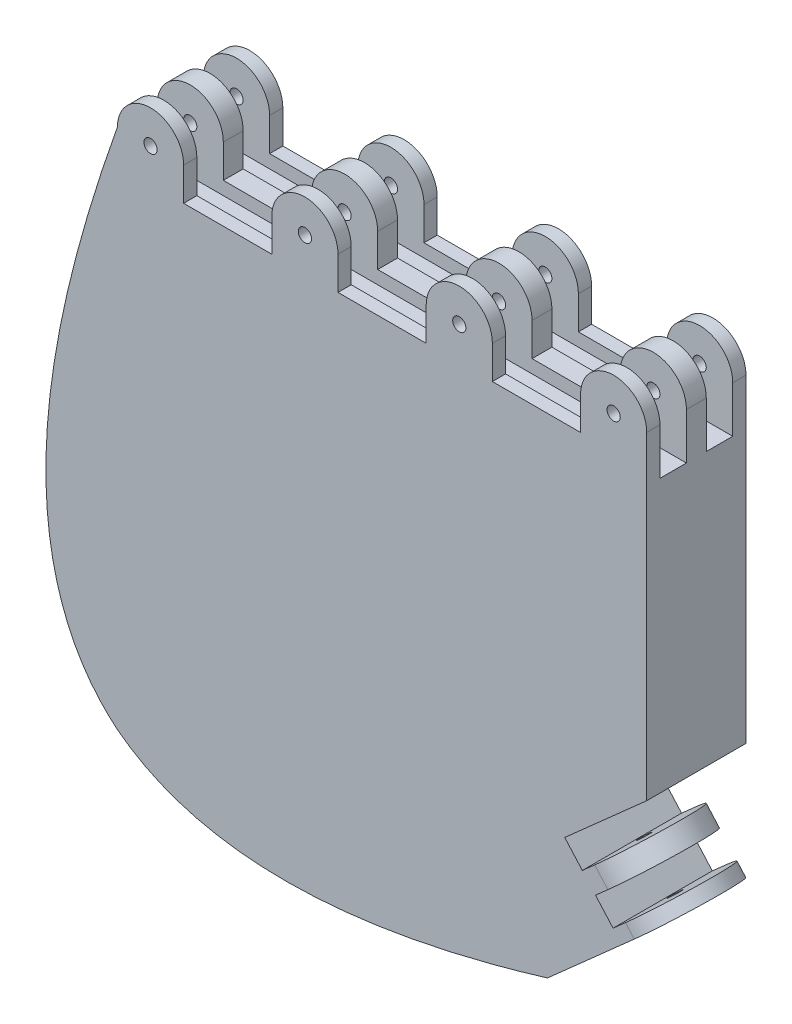
from build123d import *

# Parameters (mm, degrees)
BOSS_EXTRU_1_DEPTH      = 12.5
BOSS_EXTRU_1_DEPTH_BACK = 2.5
ESQUISSE1_R             = 1
ESQUISSE2_W             = 4
ESQUISSE2_H             = 12
ENL_V_MAT_EXTRU_1_DEPTH = 113.378931374
ESQUISSE3_R             = 1
ENL_V_MAT_EXTRU_2_DEPTH = 12.5


with BuildPart() as part:
    # Esquisse1 → Boss.-Extru.1 (new, two sides: drawn at the far end of the back side and taken through both)
    with BuildSketch(Plane.XY.offset(-BOSS_EXTRU_1_DEPTH_BACK)):
        with BuildLine():
            add(Edge.make_bspline(
                [(-75, -18.910504263), (-56.686373288, -33.096877551), (-10, -18.910504263)],
                knots=[0.563496207, 0.563496207, 0.563496207, 1, 1, 1], degree=2))
            Line((-10, -18.910504263), (8.718662863, -2.287994294))
            Line((8.718662863, -2.287994294), (7.390662863, -0.792529149))
            Line((7.390662863, -0.792529149), (-0.086662863, -7.432529149))
            Line((-0.086662863, -7.432529149), (-2.742662863, -4.441598859))
            Line((-2.742662863, -4.441598859), (4.734662863, 2.198401141))
            Line((4.734662863, 2.198401141), (2.742662863, 4.441598859))
            Line((2.742662863, 4.441598859), (-4.734662863, -2.198401141))
            Line((-4.734662863, -2.198401141), (-7.390662863, 0.792529149))
            Line((-7.390662863, 0.792529149), (5, 11.795661075))
            Line((5, 11.795661075), (5, 60))
            ThreePointArc((5, 60), (0, 65), (-5, 60))
            Line((-5, 60), (-5, 55))
            Line((-5, 55), (-18.333333333, 55))
            Line((-18.333333333, 55), (-18.333333333, 60))
            ThreePointArc((-18.333333333, 60), (-23.333333333, 65), (-28.333333333, 60))
            Line((-28.333333333, 60), (-28.333333333, 55))
            Line((-28.333333333, 55), (-41.666666667, 55))
            Line((-41.666666667, 55), (-41.666666667, 60))
            ThreePointArc((-41.666666667, 60), (-46.666666667, 65), (-51.666666667, 60))
            Line((-51.666666667, 60), (-51.666666667, 55))
            Line((-51.666666667, 55), (-65, 55))
            Line((-65, 55), (-65, 60))
            ThreePointArc((-65, 60), (-70, 65), (-75, 60))
            add(Edge.make_bspline(
                [(-75, 60), (-96.634514155, -1.089766286), (-75, -18.910504263)],
                knots=[0, 0, 0, 0.548330399, 0.548330399, 0.548330399], degree=2))
        make_face()
        with Locations((-70, 60)):
            Circle(ESQUISSE1_R, mode=Mode.SUBTRACT)
        with Locations((-46.666666667, 60)):
            Circle(ESQUISSE1_R, mode=Mode.SUBTRACT)
        with Locations((-23.333333333, 60)):
            Circle(ESQUISSE1_R, mode=Mode.SUBTRACT)
        with Locations((0, 60)):
            Circle(ESQUISSE1_R, mode=Mode.SUBTRACT)
    extrude(amount=BOSS_EXTRU_1_DEPTH + BOSS_EXTRU_1_DEPTH_BACK)

    # Esquisse2 → Enlèv. mat.-Extru.1 (cut, through all)
    with BuildSketch(Plane(origin=(5, 0, 0), x_dir=(0, 0, -1), z_dir=(1, 0, 0))):
        with Locations((-8.5, 59)):
            Rectangle(ESQUISSE2_W, ESQUISSE2_H)
        with Locations((-1.5, 59)):
            Rectangle(ESQUISSE2_W, ESQUISSE2_H)
    extrude(amount=-ENL_V_MAT_EXTRU_1_DEPTH, mode=Mode.SUBTRACT)

    # Esquisse3 → Enlèv. mat.-Extru.2 (cut)
    with BuildSketch(Plane(origin=(4.98, -5.607994294, 0), x_dir=(0.7477325725150671, 0.6640000000000001, 0), z_dir=(0.6640000000000001, -0.7477325725150671, 0))):
        with BuildLine():
            Line((5, 12.5), (-2.5, 12.5))
            ThreePointArc((-2.5, 12.5), (2.803300859, 10.303300859), (5, 5))
            Line((5, 5), (5, 12.5))
        make_face()
        with Locations((-2.5, 5)):
            Circle(ESQUISSE3_R)
        with BuildLine():
            Line((5, -2.5), (5, 5))
            ThreePointArc((5, 5), (2.803300859, -0.303300859), (-2.5, -2.5))
            Line((-2.5, -2.5), (5, -2.5))
        make_face()
    extrude(amount=-ENL_V_MAT_EXTRU_2_DEPTH, mode=Mode.SUBTRACT)


solid = part.part
